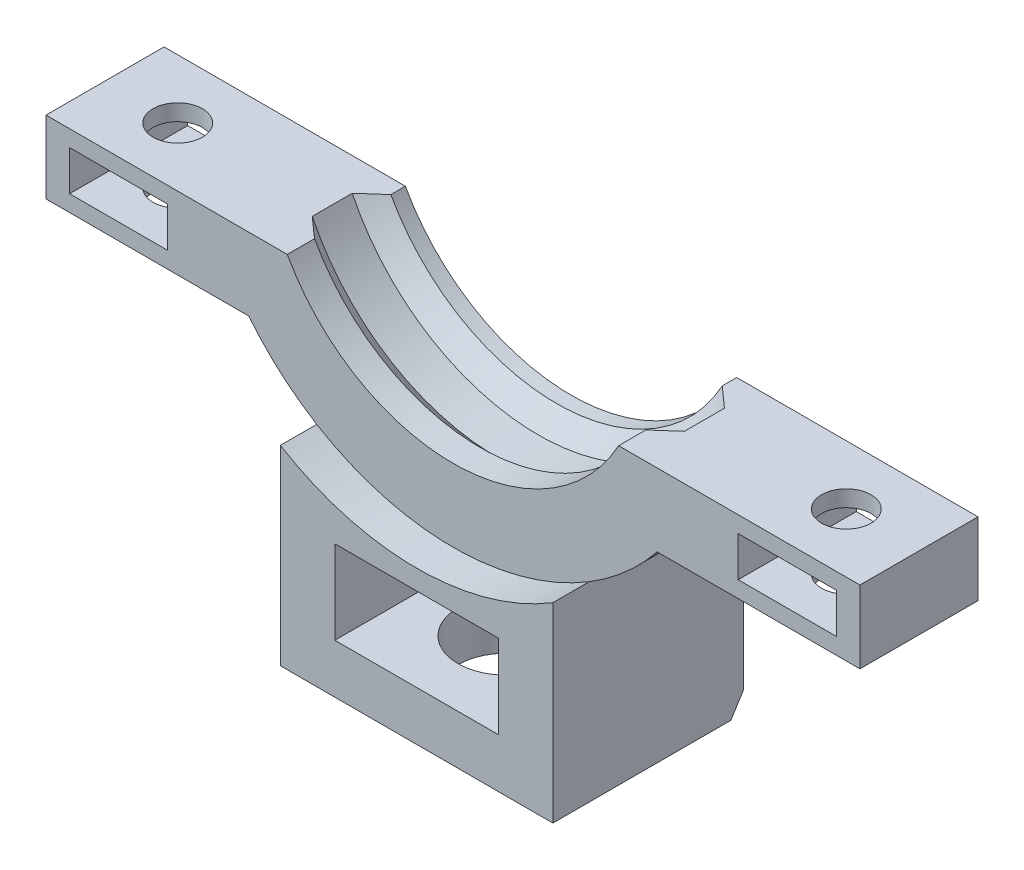
from build123d import *

# Parameters (mm, degrees)
SKETCH1_R                   = 18.288
BOSS_EXTRUDE1_DEPTH         = 19.05
SKETCH3_R                   = 13.208
CUT_EXTRUDE1_DEPTH          = 33.121712096
SKETCH15_W                  = 19.05
SKETCH15_H                  = 17.526
BOSS_EXTRUDE3_DEPTH         = 15.24
SKETCH16_W                  = 11.43
SKETCH16_H                  = 5.842
CUT_EXTRUDE4_DEPTH          = 39.82462909
CHAMFER1_SIZE               = 8.129699408
CHAMFER1_SIZE_2             = 5.08
F_1_4_CLEARANCE_HOLE1_D     = 6.7564
F_1_4_CLEARANCE_HOLE1_DEPTH = 3.448428068
SKETCH19_R                  = 18.288
SKETCH19_R_2                = 13.208
CUT_EXTRUDE5_DEPTH          = 0.762
CUT_EXTRUDE6_START          = -2.54
SKETCH20_R                  = 18.288
CUT_EXTRUDE6_DEPTH          = 2.54
SKETCH21_R                  = 18.288
CUT_EXTRUDE7_DEPTH          = 7.493
SKETCH22_W                  = 19.05
SKETCH22_H                  = 4.191
CUT_EXTRUDE8_DEPTH          = 42.148
SKETCH24_R                  = 14.478
CUT_EXTRUDE10_DEPTH         = 5.334
SKETCH25_W                  = 8.255
SKETCH25_H                  = 5.08
BOSS_EXTRUDE4_DEPTH         = 15.24
F_4_CLEARANCE_HOLE1_D       = 3.4544
SKETCH28_W                  = 6.858
SKETCH28_H                  = 2.794
CUT_EXTRUDE11_DEPTH         = 43.003222079
MIRROR3_COPY_1_SKETCH_W     = 6.858
MIRROR3_COPY_1_SKETCH_H     = 2.794
MIRROR3_COPY_1_DEPTH        = 43.003222079
SKETCH30_W                  = 69.645379109
SKETCH30_H                  = 31.008453513
CUT_EXTRUDE13_DEPTH         = 24.638
CHAMFER2_SIZE               = 1.27


# Some blends are built 0.0001 mm under size
with BuildPart() as part:
    # Sketch1 → Boss-Extrude1 (new body)
    with BuildSketch(Plane.XY):
        with Locations(Location((0, 0, 0), (0, 0, 180))):
            Circle(SKETCH1_R)
    extrude(amount=BOSS_EXTRUDE1_DEPTH)

    # Sketch3 → Cut-Extrude1 (cut, through all)
    with BuildSketch(Plane.XY.offset(19.05)):
        Circle(SKETCH3_R)
    extrude(amount=-CUT_EXTRUDE1_DEPTH, mode=Mode.SUBTRACT)

    # Sketch15 → Boss-Extrude3 (add)
    with BuildSketch(Plane(origin=(0, -13.716, 0), x_dir=(1, 0, 0), z_dir=(0, 1, 0))):
        with Locations((0, -9.525)):
            Rectangle(SKETCH15_W, SKETCH15_H)
    extrude(amount=-BOSS_EXTRUDE3_DEPTH)

    # Sketch16 → Cut-Extrude4 (cut, through all)
    with BuildSketch(Plane.XY.offset(18.288)):
        with Locations((0, -22.586571932)):
            Rectangle(SKETCH16_W, SKETCH16_H)
    extrude(amount=-CUT_EXTRUDE4_DEPTH, mode=Mode.SUBTRACT)

    # Chamfer1
    # the kernel refuses this chamfer: 8.129699408, 5.08 mm, written as the material it takes off along each edge
    with BuildSketch(Plane(origin=(-30.543101737, -28.956, 0.762), x_dir=(0, 0.9997899140358644, -0.020497019104217945), z_dir=(1, 0, 0))) as chamfer1_piece_1:
        Polygon((CHAMFER1_SIZE * 0.999789913978, CHAMFER1_SIZE * 0.020497019103), (-CHAMFER1_SIZE_2 * 0.0204970191042, CHAMFER1_SIZE_2 * 0.999789914036), (0, 0), align=None)
    extrude(amount=61.086203475, mode=Mode.SUBTRACT)

    # 1/4 Clearance Hole1
    with Locations(Plane(origin=(0, -28.956, 0), x_dir=(-1, 0, 0), z_dir=(0, -1, 0))):
        with Locations((0, -12.021417661)):
            Hole(F_1_4_CLEARANCE_HOLE1_D / 2, depth=F_1_4_CLEARANCE_HOLE1_DEPTH)

    # Sketch19 → Cut-Extrude5 (cut)
    with BuildSketch(Plane.XY.offset(19.05)):
        with Locations(Location((0, 0, 0), (0, 0, 238.611833536))):
            Circle(SKETCH19_R)
        Circle(SKETCH19_R_2, mode=Mode.SUBTRACT)
    extrude(amount=-CUT_EXTRUDE5_DEPTH, mode=Mode.SUBTRACT)

    # Sketch20 → Cut-Extrude6 (cut)
    with BuildSketch(Plane.XY.offset(18.288).offset(CUT_EXTRUDE6_START)):
        with Locations(Location((0, 0, 0), (0, 0, 238.611833536))):
            Circle(SKETCH20_R)
    extrude(amount=CUT_EXTRUDE6_DEPTH, mode=Mode.SUBTRACT)

    # Sketch21 → Cut-Extrude7 (cut)
    with BuildSketch(Plane(origin=(0, 0, 0), x_dir=(-1, 0, 0), z_dir=(0, 0, -1))):
        Circle(SKETCH21_R)
    extrude(amount=-CUT_EXTRUDE7_DEPTH, mode=Mode.SUBTRACT)

    # Sketch22 → Cut-Extrude8 (cut, through all)
    with BuildSketch(Plane(origin=(0, -13.716, 0), x_dir=(1, 0, 0), z_dir=(0, 1, 0))):
        with Locations((0, -2.8575)):
            Rectangle(SKETCH22_W, SKETCH22_H)
    extrude(amount=-CUT_EXTRUDE8_DEPTH, mode=Mode.SUBTRACT)

    # Sketch24 → Cut-Extrude10 (cut)
    with BuildSketch(Plane.XY.offset(13.843)):
        Circle(SKETCH24_R)
    extrude(amount=-CUT_EXTRUDE10_DEPTH, mode=Mode.SUBTRACT)

    # Sketch25 → Boss-Extrude4 (add)
    with BuildSketch(Plane(origin=(13.208, 0, 0), x_dir=(0, 0, -1), z_dir=(1, 0, 0))):
        with Locations((-11.6205, 8.89)):
            Rectangle(SKETCH25_W, SKETCH25_H)
        with Locations((-11.6205, -8.89)):
            Rectangle(SKETCH25_W, SKETCH25_H)
    boss_extrude4 = extrude(amount=BOSS_EXTRUDE4_DEPTH)

    # #4 Clearance Hole1 (through all)
    with Locations(Plane(origin=(0, -11.43, 0), x_dir=(-1, 0, 0), z_dir=(0, -1, 0))):
        with Locations((-23.368, -11.6205)):
            f_4_clearance_hole1 = Hole(F_4_CLEARANCE_HOLE1_D / 2)

    # Sketch28 → Cut-Extrude11 (cut, through all)
    with BuildSketch(Plane.XY.offset(15.748)):
        with Locations((23.368, -8.89)):
            Rectangle(SKETCH28_W, SKETCH28_H)
    cut_extrude11 = extrude(amount=-CUT_EXTRUDE11_DEPTH, mode=Mode.SUBTRACT)

    # Mirror2: Cut-Extrude11 across plane
    add(cut_extrude11.mirror(Plane.ZX), mode=Mode.SUBTRACT)

    # Mirror3: Boss-Extrude4, #4 Clearance Hole1, Cut-Extrude11 across plane
    add(boss_extrude4.mirror(Plane(origin=(0, 0, 0), x_dir=(0, 0, 1), z_dir=(1, 0, 0))))
    add(f_4_clearance_hole1.mirror(Plane(origin=(0, 0, 0), x_dir=(0, 0, 1), z_dir=(1, 0, 0))), mode=Mode.SUBTRACT)
    add(cut_extrude11.mirror(Plane(origin=(0, 0, 0), x_dir=(0, 0, 1), z_dir=(1, 0, 0))), mode=Mode.SUBTRACT)

    # Mirror3 copy 1 sketch → Mirror3 copy 1 (cut, through all)
    with BuildSketch(Plane(origin=(0, 0, 15.748), x_dir=(-1, 0, 0), z_dir=(0, 0, 1))):
        with Locations((23.368, -8.89)):
            Rectangle(MIRROR3_COPY_1_SKETCH_W, MIRROR3_COPY_1_SKETCH_H)
    extrude(amount=-MIRROR3_COPY_1_DEPTH, mode=Mode.SUBTRACT)

    # Sketch30 → Cut-Extrude13 (cut)
    with BuildSketch(Plane(origin=(0, 18.288, 0), x_dir=(1, 0, 0), z_dir=(0, 1, 0))):
        with Locations((0.103127413, -15.504226757)):
            Rectangle(SKETCH30_W, SKETCH30_H)
    extrude(amount=-CUT_EXTRUDE13_DEPTH, mode=Mode.SUBTRACT)

    # Chamfer2
    chamfer2_edges = [part.edges().sort_by_distance(p)[0] for p in [
        (0, -14.478, 13.843),
        (0, -14.478, 8.509),
    ]]
    chamfer(chamfer2_edges, length=CHAMFER2_SIZE - 0.0001)  # a hair under: the kernel refuses the full size


solid = part.part
